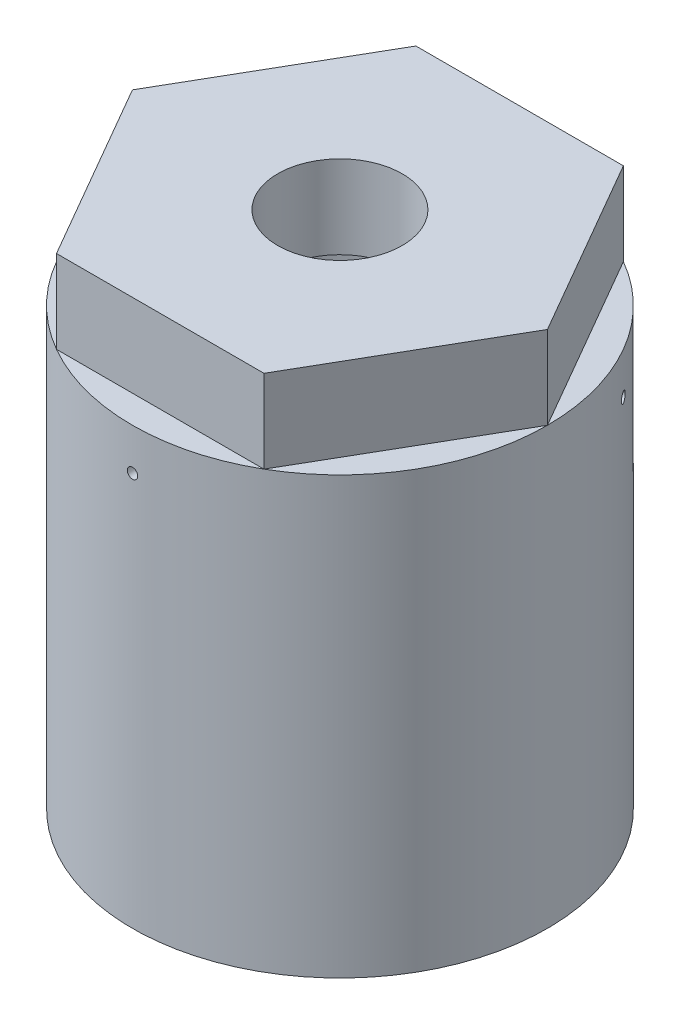
from build123d import *

# Parameters (mm, degrees)
SCHIZZO2_R                  = 6
TAGLIO_ESTRUSIONE1_DEPTH    = 11
SCHIZZO3_R                  = 0.5
TAGLIO_ESTRUSIONE2_DEPTH    = 10
RIPETIZIONECIRCOLARE1_COUNT = 3
RACCORDO1_R                 = 0.5
TAGLIO_ESTRUSIONE3_START    = -8
TAGLIO_ESTRUSIONE3_DEPTH    = 8


with BuildPart() as part:
    # Schizzo1 → Rivoluzione1 (revolve)
    with BuildSketch(Plane.XY):
        Polygon((-15, 5), (-14, 6), (-14, 30), (0, 30), (0, 38), (-20, 38), (-20, -12), (-18, -12), (-18, 0), (-15, 0), align=None)
    revolve(axis=Axis((0, 0, 0), (0, 1, 0)))

    # Schizzo2 → Taglio-Estrusione1 (cut)
    with BuildSketch(Plane(origin=(0, 38, 0), x_dir=(1, 0, 0), z_dir=(0, 1, 0))):
        Circle(SCHIZZO2_R)
    extrude(amount=-TAGLIO_ESTRUSIONE1_DEPTH, mode=Mode.SUBTRACT)

    # Schizzo3 → Taglio-Estrusione2 (cut)
    with BuildSketch(Plane.XY.offset(20)):
        with Locations((0, 26)):
            Circle(SCHIZZO3_R)
    taglio_estrusione2 = extrude(amount=-TAGLIO_ESTRUSIONE2_DEPTH, mode=Mode.SUBTRACT)

    # RipetizioneCircolare1: Taglio-Estrusione2 ×3 about axis
    ripetizionecircolare1_axis = Axis((0, 38, 0), (0, -1, 0))
    for i in range(1, RIPETIZIONECIRCOLARE1_COUNT):
        add(taglio_estrusione2.rotate(ripetizionecircolare1_axis, i * 360 / RIPETIZIONECIRCOLARE1_COUNT), mode=Mode.SUBTRACT)

    # Raccordo1
    raccordo1_edges = [part.edges().sort_by_distance(p)[0] for p in [
        (14, 30, 0),
    ]]
    fillet(raccordo1_edges, radius=RACCORDO1_R)

    # Schizzo4 → Taglio-Estrusione3 (cut)
    with BuildSketch(Plane(origin=(0, 38, 0), x_dir=(1, 0, 0), z_dir=(0, 1, 0)).offset(TAGLIO_ESTRUSIONE3_START)):
        with BuildLine():
            ThreePointArc((10, 17.320508076), (0, 20), (-10, 17.320508076))
            Line((-10, 17.320508076), (10, 17.320508076))
        make_face()
        with BuildLine():
            Line((-20, 0), (-10, 17.320508076))
            ThreePointArc((-10, 17.320508076), (-17.320508076, 10), (-20, 0))
        make_face()
        with BuildLine():
            Line((-10, -17.320508076), (-20, 0))
            ThreePointArc((-20, 0), (-17.320508076, -10), (-10, -17.320508076))
        make_face()
        with BuildLine():
            ThreePointArc((20, 0), (17.320508076, 10), (10, 17.320508076))
            Line((10, 17.320508076), (20, 0))
        make_face()
        with BuildLine():
            Line((10, -17.320508076), (-10, -17.320508076))
            ThreePointArc((-10, -17.320508076), (0, -20), (10, -17.320508076))
        make_face()
        with BuildLine():
            ThreePointArc((10, -17.320508076), (17.320508076, -10), (20, 0))
            Line((20, 0), (10, -17.320508076))
        make_face()
    extrude(amount=TAGLIO_ESTRUSIONE3_DEPTH, mode=Mode.SUBTRACT)


solid = part.part
